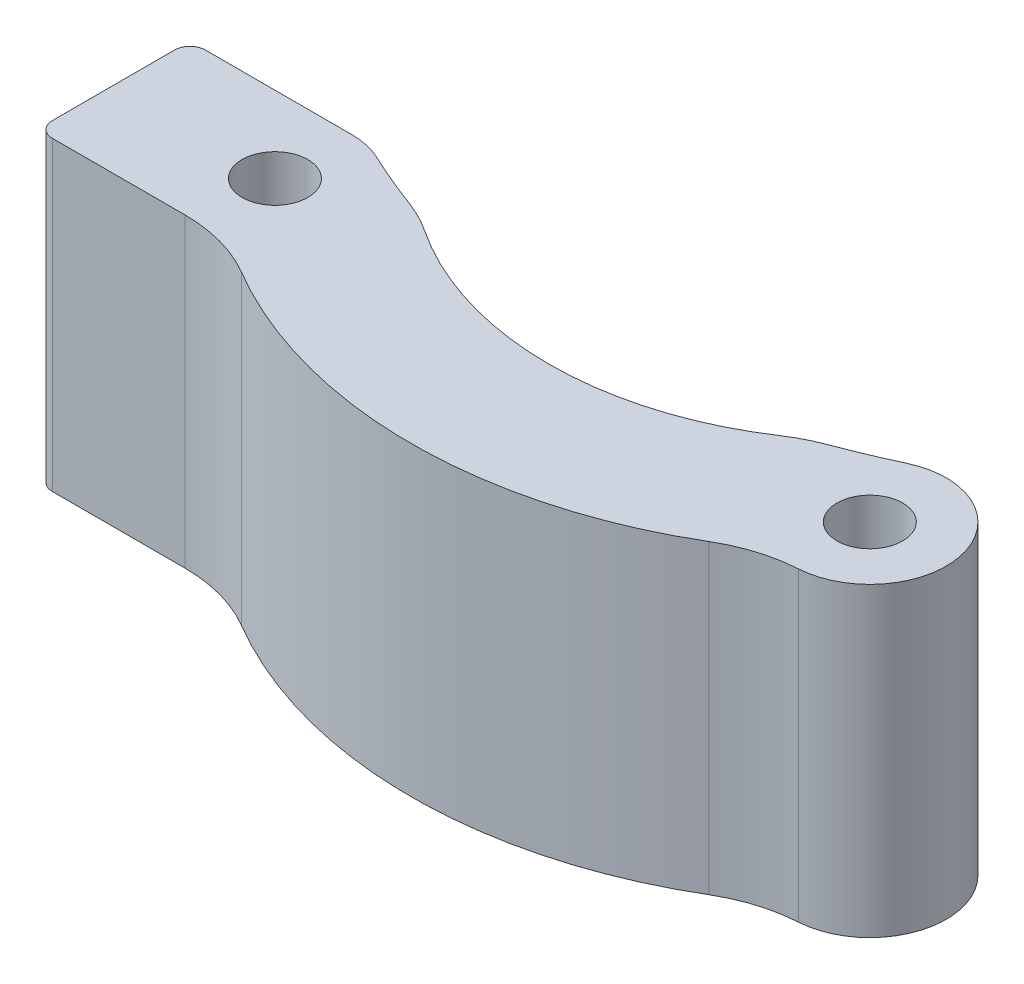
from build123d import *

# Parameters (mm, degrees)
SKETCH_1_R      = 2.15
EXTRUDE_1_DEPTH = 20
FILLET_1_R      = 10
FILLET_2_R      = 50
FILLET_3_R      = 1


with BuildPart() as part:
    # ｽｹｯﾁ1 → ﾎﾞｽ - 押し出し1 (new body)
    with BuildSketch(Plane(origin=(0, 0, 0), x_dir=(1, 0, 0), z_dir=(0, 1, 0))):
        with BuildLine():
            Line((-30, -24.445436483), (-19.445436483, -24.445436483))
            ThreePointArc((-19.445436483, -24.445436483), (-18.602258519, -24.373828809), (-17.78323176, -24.161056851))
            ThreePointArc((-17.78323176, -24.161056851), (0, -30), (17.78323176, -24.161056851))
            ThreePointArc((17.78323176, -24.161056851), (24.321347518, -18.338417254), (15.909902577, -15.909902577))
            Line((15.909902577, -15.909902577), (14.849242405, -14.849242405))
            ThreePointArc((14.849242405, -14.849242405), (0, -21), (-14.849242405, -14.849242405))
            Line((-14.849242405, -14.849242405), (-15.909902577, -15.909902577))
            ThreePointArc((-15.909902577, -15.909902577), (-17.532019321, -14.82603882), (-19.445436483, -14.445436483))
            Line((-19.445436483, -14.445436483), (-30, -14.445436483))
            Line((-30, -14.445436483), (-30, -24.445436483))
        make_face()
        with Locations(Location((-19.445436483, -19.445436483, 0), (0, 0, 270))):
            Circle(SKETCH_1_R, mode=Mode.SUBTRACT)
        with Locations(Location((19.445436483, -19.445436483, 0), (0, 0, 90))):
            Circle(SKETCH_1_R, mode=Mode.SUBTRACT)
    extrude(amount=EXTRUDE_1_DEPTH)

    # ﾌｨﾚｯﾄ1
    # the kernel refuses this fillet: 10 mm, written as the material it adds along each edge
    with BuildSketch(Plane(origin=(17.78323176, 0, 24.161056851), x_dir=(-0.8339213468601729, 0, 0.5518833094512962), z_dir=(0, 1, 0))) as fillet_1_piece_1:
        with BuildLine():
            CenterArc((3.490042654, 9.987563289), FILLET_1_R, 240.094065847, 27.048110546)
            ThreePointArc((-1.495732566, 1.319112133), (-0.681431037, 0.734886554), (0, 0))
            ThreePointArc((0, 0), (1.495732566, 0.037310133), (2.991465132, 0))
        make_face()
    extrude(amount=20)
    with BuildSketch(Plane(origin=(-17.78323176, 0, 24.161056851), x_dir=(-0.9938473156865714, 0, 0.11075880598217346), z_dir=(0, 1, 0))) as fillet_1_piece_2:
        with BuildLine():
            CenterArc((3.675145817, 9.938473157), FILLET_1_R, 233.085304015, 30.555636739)
            Line((-2.331107377, 1.943166873), (-2.931732696, 1.143636244))
            ThreePointArc((-2.931732696, 1.143636244), (-1.781263353, 0.232951381), (-0.678328899, -0.734758399))
            Line((-0.678328899, -0.734758399), (0.225936244, -0.974142091))
            ThreePointArc((0.225936244, -0.974142091), (1.572716444, -0.895321193), (2.456798951, -0.993847316))
            Line((2.456798951, -0.993847316), (2.567557757, 0))
        make_face()
    extrude(amount=20)
    # the kernel refuses this fillet: 10 mm, written as the material it takes off along each edge
    with BuildSketch(Plane(origin=(-14.849242405, -10.471736153, 14.849242405), x_dir=(-0.707106781186226, 0, 0.7071067811868691), z_dir=(0, 1, 0))) as fillet_1_2_piece_1:
        with BuildLine():
            CenterArc((9.383333333, 6.15248369), FILLET_1_R, 191.447340283, 26.522629156)
            ThreePointArc((-0.417741935, 4.167811532), (-0.104696468, 2.094347231), (0, 0))
            Line((0, 0), (1.5, 0))
        make_face()
    extrude(amount=40.943472307, mode=Mode.SUBTRACT)
    with BuildSketch(Plane(origin=(14.849242405, -10.471736153, 14.849242405), x_dir=(-0.7741018071953127, 0, 0.6330611282466734), z_dir=(0, 1, 0))) as fillet_1_2_piece_2:
        with BuildLine():
            CenterArc((5.186002666, 9.950144539), FILLET_1_R, 237.753700702, 26.522629156)
            Line((-0.149596231, 1.492521681), (0, 0))
            ThreePointArc((0, 0), (2.094347231, 0.104696468), (4.188694461, 0))
        make_face()
    extrude(amount=40.943472307, mode=Mode.SUBTRACT)

    # ﾌｨﾚｯﾄ2
    fillet_2_edges = [part.edges().sort_by_distance(p)[0] for p in [
        (-15.909902577, 10, 15.909902577),
        (15.909902577, 10, 15.909902577),
    ]]
    fillet(fillet_2_edges, radius=FILLET_2_R)

    # ﾌｨﾚｯﾄ3
    fillet_3_edges = [part.edges().sort_by_distance(p)[0] for p in [
        (-30, 10, 14.445436483),
        (-30, 10, 24.445436483),
    ]]
    fillet(fillet_3_edges, radius=FILLET_3_R)


solid = part.part
